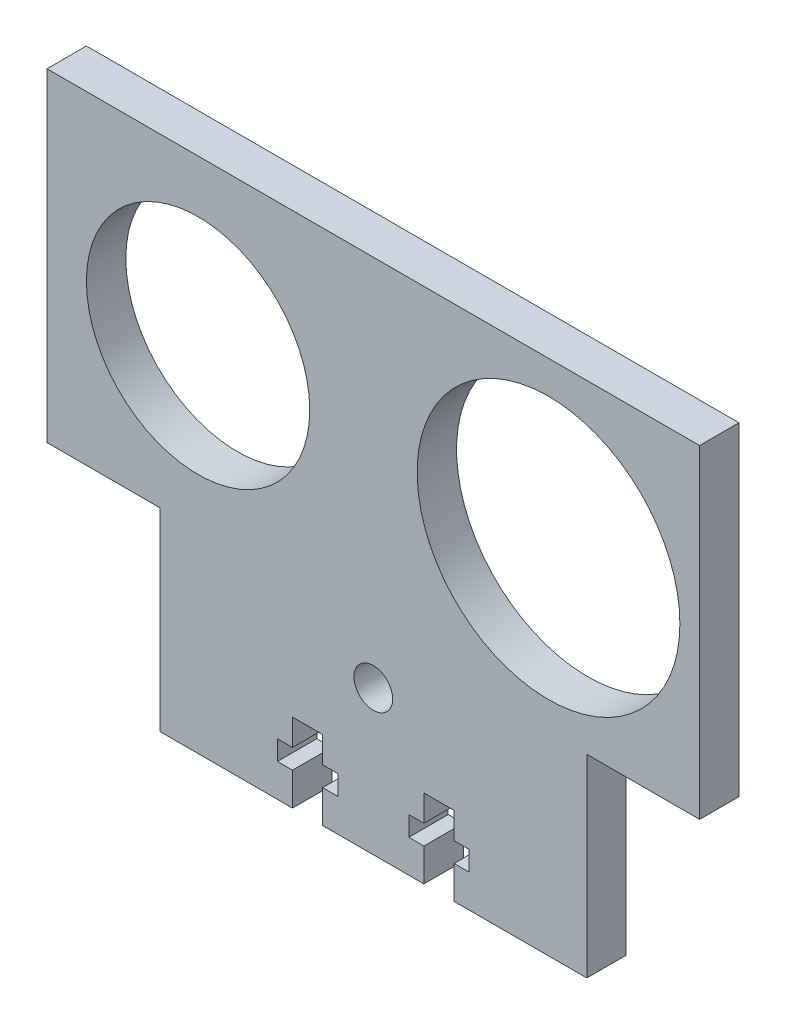
from build123d import *

# Parameters (mm, degrees)
SKETCH1_R           = 2.95
SKETCH1_R_2         = 17
SKETCH1_R_3         = 20
BOSS_EXTRUDE1_DEPTH = 6
CUT_EXTRUDE2_DEPTH  = 76.689323992


with BuildPart() as part:
    # Sketch1 → Boss-Extrude1 (new body)
    with BuildSketch(Plane.XY):
        Polygon((-32.5, 7.5), (-32.5, -22), (32.5, -22), (32.5, 7.5), (49.675685802, 7.5), (49.675685802, 56.790844389), (-49.675685802, 56.790844389), (-49.675685802, 7.5), align=None)
        Circle(SKETCH1_R, mode=Mode.SUBTRACT)
        with Locations((-26.675685802, 31.790844389)):
            Circle(SKETCH1_R_2, mode=Mode.SUBTRACT)
        with Locations((26.675685802, 31.790844389)):
            Circle(SKETCH1_R_3, mode=Mode.SUBTRACT)
    extrude(amount=BOSS_EXTRUDE1_DEPTH)

    # Sketch3 → Cut-Extrude2 (cut, through all)
    with BuildSketch(Plane.XY.offset(6)):
        Polygon((-12.3, -22), (-7.7, -22), (-7.7, -17), (-5.4, -17), (-5.4, -14), (-7.7, -14), (-7.7, -10), (-12.3, -10), (-12.3, -14), (-14.6, -14), (-14.6, -17), (-12.3, -17), align=None)
        Polygon((7.7, -14), (7.7, -10), (12.3, -10), (12.3, -14), (14.6, -14), (14.6, -17), (12.3, -17), (12.3, -22), (7.7, -22), (7.7, -17), (5.4, -17), (5.4, -14), align=None)
    extrude(amount=-CUT_EXTRUDE2_DEPTH, mode=Mode.SUBTRACT)


solid = part.part
